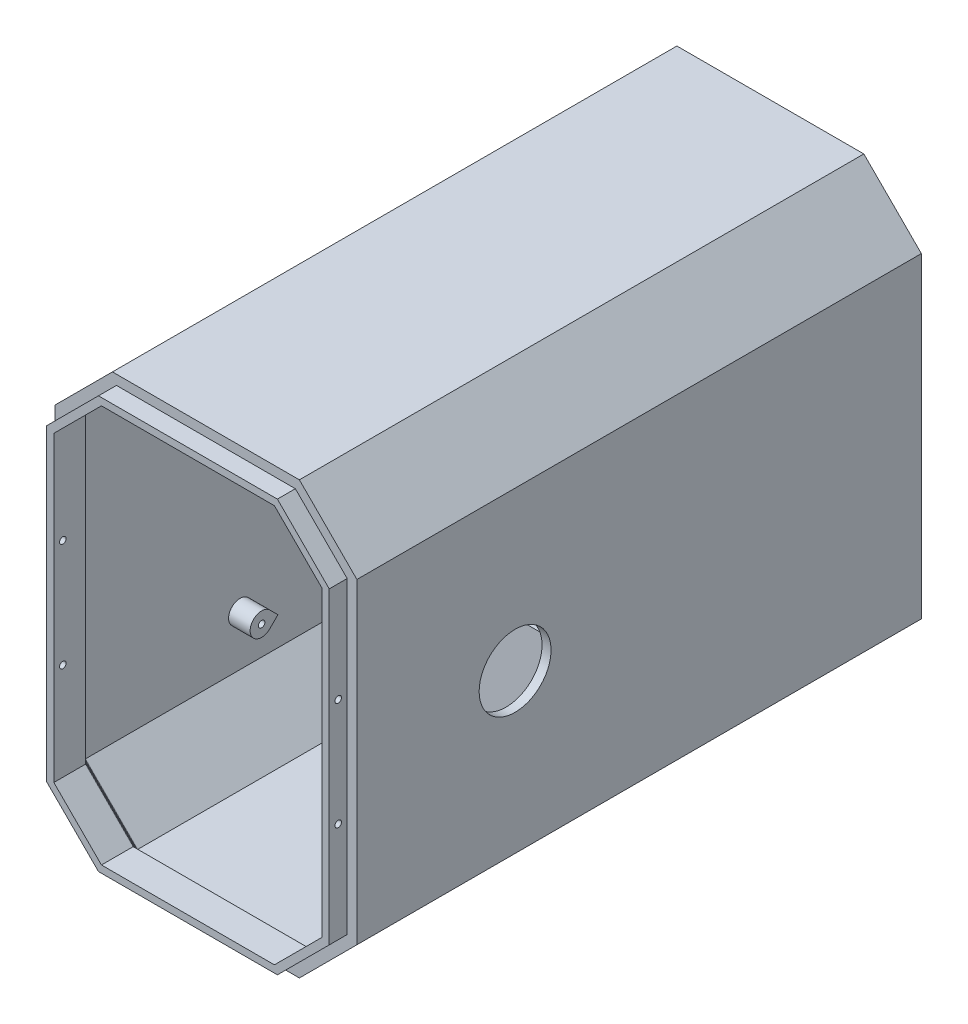
from build123d import *

# Parameters (mm, degrees)
BOSS_1_DEPTH    = 157
CUT_2_DEPTH     = 122.675
CUT_3_DEPTH     = 32.025
S_CUT4_W        = 8
S_CUT4_H        = 28
POCKET_4_DEPTH  = 2.7
S_HOLE5_R       = 6
HOLE_5_DEPTH    = 2.7
S_CUT6_W        = 19.4
S_CUT6_H        = 6.3
POCKET_6_DEPTH  = 2.7
S_CUT7_W        = 19.4
S_CUT7_H        = 6.3
POCKET_7_DEPTH  = 2.7
S_HOLE8_R       = 1.7
HOLE_8_DEPTH    = 2.7
S_HOLE9_R       = 1.7
HOLE_9_DEPTH    = 2.7
S_HOLE10_R      = 1.7
HOLE_10_DEPTH   = 2.7
S_HOLE11_R      = 1.7
HOLE_11_DEPTH   = 2.7
BOSS_12_DEPTH   = 6
BOSS_13_DEPTH   = 5.1
S_CYL14_R       = 3.2
BOSS_14_DEPTH   = 6.5
BOSS_15_DEPTH   = 6.5
S_CYL16_R       = 3.2
BOSS_16_DEPTH   = 6.5
BOSS_17_DEPTH   = 6.5
S_CYL18_R       = 3.2
BOSS_18_DEPTH   = 6.5
BOSS_19_DEPTH   = 6.5
S_CYL20_R       = 3.2
BOSS_20_DEPTH   = 6.5
BOSS_21_DEPTH   = 6.5
S_BOX22_W       = 25.8
S_BOX22_H       = 69
BOSS_22_DEPTH   = 6
BOSS_23_DEPTH   = 69
CUT_24_DEPTH    = 8.9
CUT_25_DEPTH    = 0.3
CUT_26_DEPTH    = 0.3
CUT_27_DEPTH    = 0.3
CUT_28_DEPTH    = 0.3
CUT_29_DEPTH    = 0.3
CUT_30_DEPTH    = 0.3
CUT_31_DEPTH    = 0.3
CUT_32_DEPTH    = 0.3
CUT_33_DEPTH    = 0.3
CUT_34_DEPTH    = 0.3
CUT_35_DEPTH    = 0.3
S_HOLE36_R      = 0.9
HOLE_36_DEPTH   = 2.7
S_HOLE37_R      = 0.9
HOLE_37_DEPTH   = 2.7
S_HOLE38_R      = 0.9
HOLE_38_DEPTH   = 2.7
S_HOLE39_R      = 0.9
HOLE_39_DEPTH   = 2.7
S_HOLE40_R      = 0.9
HOLE_40_DEPTH   = 7.2
S_HOLE41_R      = 0.9
HOLE_41_DEPTH   = 7.2
S_HOLE42_R      = 0.9
HOLE_42_DEPTH   = 7.2
S_HOLE43_R      = 0.9
HOLE_43_DEPTH   = 7.2
S_HOLE44_R      = 10
HOLE_44_DEPTH   = 3.1
S_CUT45_W       = 24.9
S_CUT45_H       = 10
POCKET_45_DEPTH = 4.1
S_HOLE46_R      = 0.9
HOLE_46_DEPTH   = 9.1
S_HOLE47_R      = 0.9
HOLE_47_DEPTH   = 9.1


with BuildPart() as part:
    # S_prism1 → Boss_1 (new body)
    with BuildSketch(Plane.XY.offset(37)):
        Polygon((42, -44), (42, 44), (26, 60), (-26, 60), (-42, 44), (-42, -44), (-26, -60), (26, -60), align=None)
    extrude(amount=BOSS_1_DEPTH)

    # S_pcut2 → Cut_2 (cut)
    with BuildSketch(Plane.XY.offset(71.425)):
        Polygon((39.5, -42.964466094), (39.5, 42.964466094), (24.964466094, 57.5), (-24.964466094, 57.5), (-39.5, 42.964466094), (-39.5, -42.964466094), (-24.964466094, -57.5), (24.964466094, -57.5), align=None)
    extrude(amount=CUT_2_DEPTH, mode=Mode.SUBTRACT)

    # S_pcut3 → Cut_3 (cut)
    with BuildSketch(Plane.XY.offset(36.9)):
        Polygon((39.5, -42.964466094), (39.5, 42.964466094), (24.964466094, 57.5), (-24.964466094, 57.5), (-39.5, 42.964466094), (-39.5, -42.964466094), (-24.964466094, -57.5), (24.964466094, -57.5), align=None)
    extrude(amount=CUT_3_DEPTH, mode=Mode.SUBTRACT)

    # S_cut4 → Pocket_4 (cut)
    with BuildSketch(Plane.XY.offset(68.825)):
        with Locations((-30, 0)):
            Rectangle(S_CUT4_W, S_CUT4_H)
    extrude(amount=POCKET_4_DEPTH, mode=Mode.SUBTRACT)

    # S_hole5 → Hole_5 (cut)
    with BuildSketch(Plane(origin=(-42.1, 0, 0), x_dir=(0, 0, -1), z_dir=(1, 0, 0))):
        with Locations((-88, 0)):
            Circle(S_HOLE5_R)
    extrude(amount=HOLE_5_DEPTH, mode=Mode.SUBTRACT)

    # S_cut6 → Pocket_6 (cut)
    with BuildSketch(Plane.XY.offset(68.825)):
        with Locations((0, 30.95)):
            Rectangle(S_CUT6_W, S_CUT6_H)
    extrude(amount=POCKET_6_DEPTH, mode=Mode.SUBTRACT)

    # S_cut7 → Pocket_7 (cut)
    with BuildSketch(Plane.XY.offset(68.825)):
        with Locations((0, -30.95)):
            Rectangle(S_CUT7_W, S_CUT7_H)
    extrude(amount=POCKET_7_DEPTH, mode=Mode.SUBTRACT)

    # S_hole8 → Hole_8 (cut)
    with BuildSketch(Plane.XY.offset(68.825)):
        with Locations((-20, -25)):
            Circle(S_HOLE8_R)
    extrude(amount=HOLE_8_DEPTH, mode=Mode.SUBTRACT)

    # S_hole9 → Hole_9 (cut)
    with BuildSketch(Plane.XY.offset(68.825)):
        with Locations((-20, 25)):
            Circle(S_HOLE9_R)
    extrude(amount=HOLE_9_DEPTH, mode=Mode.SUBTRACT)

    # S_hole10 → Hole_10 (cut)
    with BuildSketch(Plane.XY.offset(68.825)):
        with Locations((24, -25)):
            Circle(S_HOLE10_R)
    extrude(amount=HOLE_10_DEPTH, mode=Mode.SUBTRACT)

    # S_hole11 → Hole_11 (cut)
    with BuildSketch(Plane.XY.offset(68.825)):
        with Locations((24, 25)):
            Circle(S_HOLE11_R)
    extrude(amount=HOLE_11_DEPTH, mode=Mode.SUBTRACT)

    # S_prism12 → Boss_12 (add)
    with BuildSketch(Plane.XY.offset(188)):
        Polygon((40, -43.171572875), (40, 43.171572875), (25.171572875, 58), (-25.171572875, 58), (-40, 43.171572875), (-40, -43.171572875), (-25.171572875, -58), (25.171572875, -58), align=None)
    extrude(amount=BOSS_12_DEPTH)

    # S_prism13 → Boss_13 (add)
    with BuildSketch(Plane.XY.offset(193.9)):
        Polygon((39.3, -42.881623382), (39.3, 42.881623382), (24.881623382, 57.3), (-24.881623382, 57.3), (-39.3, 42.881623382), (-39.3, -42.881623382), (-24.881623382, -57.3), (24.881623382, -57.3), align=None)
    extrude(amount=BOSS_13_DEPTH)

    # S_cyl14 → Boss_14 (add)
    with BuildSketch(Plane(origin=(-40, 0, 0), x_dir=(0, 0, -1), z_dir=(1, 0, 0))):
        with Locations((-96, -29)):
            Circle(S_CYL14_R)
    extrude(amount=BOSS_14_DEPTH)

    # S_prism15 → Boss_15 (add)
    with BuildSketch(Plane(origin=(-40, 0, 0), x_dir=(0, 0, -1), z_dir=(1, 0, 0))):
        Polygon((-93.74, -31.26), (-93.74, -26.74), (-91.47, -29), align=None)
    extrude(amount=BOSS_15_DEPTH)

    # S_cyl16 → Boss_16 (add)
    with BuildSketch(Plane(origin=(-40, 0, 0), x_dir=(0, 0, -1), z_dir=(1, 0, 0))):
        with Locations((-145, -29)):
            Circle(S_CYL16_R)
    extrude(amount=BOSS_16_DEPTH)

    # S_prism17 → Boss_17 (add)
    with BuildSketch(Plane(origin=(-40, 0, 0), x_dir=(0, 0, -1), z_dir=(1, 0, 0))):
        Polygon((-142.74, -31.26), (-142.74, -26.74), (-140.47, -29), align=None)
    extrude(amount=BOSS_17_DEPTH)

    # S_cyl18 → Boss_18 (add)
    with BuildSketch(Plane(origin=(-40, 0, 0), x_dir=(0, 0, -1), z_dir=(1, 0, 0))):
        with Locations((-96, 29)):
            Circle(S_CYL18_R)
    extrude(amount=BOSS_18_DEPTH)

    # S_prism19 → Boss_19 (add)
    with BuildSketch(Plane(origin=(-40, 0, 0), x_dir=(0, 0, -1), z_dir=(1, 0, 0))):
        Polygon((-93.74, 26.74), (-93.74, 31.26), (-91.47, 29), align=None)
    extrude(amount=BOSS_19_DEPTH)

    # S_cyl20 → Boss_20 (add)
    with BuildSketch(Plane(origin=(-40, 0, 0), x_dir=(0, 0, -1), z_dir=(1, 0, 0))):
        with Locations((-145, 29)):
            Circle(S_CYL20_R)
    extrude(amount=BOSS_20_DEPTH)

    # S_prism21 → Boss_21 (add)
    with BuildSketch(Plane(origin=(-40, 0, 0), x_dir=(0, 0, -1), z_dir=(1, 0, 0))):
        Polygon((-142.74, 26.74), (-142.74, 31.26), (-140.47, 29), align=None)
    extrude(amount=BOSS_21_DEPTH)

    # S_box22 → Boss_22 (add)
    with BuildSketch(Plane.XY.offset(126.2)):
        with Locations((27.1, 0)):
            Rectangle(S_BOX22_W, S_BOX22_H)
    extrude(amount=BOSS_22_DEPTH)

    # S_prism23 → Boss_23 (add)
    with BuildSketch(Plane(origin=(0, -34.5, 0), x_dir=(1, 0, 0), z_dir=(0, 1, 0))):
        Polygon((14.2, -126.25), (40, -126.25), (40, -100.4), align=None)
    extrude(amount=BOSS_23_DEPTH)

    # S_pcut24 → Cut_24 (cut)
    with BuildSketch(Plane.XY.offset(190.2)):
        Polygon((37.3, -42.053196257), (37.3, 42.053196257), (24.053196257, 55.3), (-24.053196257, 55.3), (-37.3, 42.053196257), (-37.3, -42.053196257), (-24.053196257, -55.3), (24.053196257, -55.3), align=None)
    extrude(amount=CUT_24_DEPTH, mode=Mode.SUBTRACT)

    # S_pcut25 → Cut_25 (cut)
    with BuildSketch(Plane.XY.offset(187.9)):
        Polygon((39.48, -42.956181823), (39.48, 42.956181823), (24.956181823, 57.48), (-24.956181823, 57.48), (-39.48, 42.956181823), (-39.48, -42.956181823), (-24.956181823, -57.48), (24.956181823, -57.48), align=None)
    extrude(amount=CUT_25_DEPTH, mode=Mode.SUBTRACT)

    # S_pcut26 → Cut_26 (cut)
    with BuildSketch(Plane.XY.offset(188.1)):
        Polygon((39.28, -42.87333911), (39.28, 42.87333911), (24.87333911, 57.28), (-24.87333911, 57.28), (-39.28, 42.87333911), (-39.28, -42.87333911), (-24.87333911, -57.28), (24.87333911, -57.28), align=None)
    extrude(amount=CUT_26_DEPTH, mode=Mode.SUBTRACT)

    # S_pcut27 → Cut_27 (cut)
    with BuildSketch(Plane.XY.offset(188.3)):
        Polygon((39.08, -42.790496398), (39.08, 42.790496398), (24.790496398, 57.08), (-24.790496398, 57.08), (-39.08, 42.790496398), (-39.08, -42.790496398), (-24.790496398, -57.08), (24.790496398, -57.08), align=None)
    extrude(amount=CUT_27_DEPTH, mode=Mode.SUBTRACT)

    # S_pcut28 → Cut_28 (cut)
    with BuildSketch(Plane.XY.offset(188.5)):
        Polygon((38.88, -42.707653685), (38.88, 42.707653685), (24.707653685, 56.88), (-24.707653685, 56.88), (-38.88, 42.707653685), (-38.88, -42.707653685), (-24.707653685, -56.88), (24.707653685, -56.88), align=None)
    extrude(amount=CUT_28_DEPTH, mode=Mode.SUBTRACT)

    # S_pcut29 → Cut_29 (cut)
    with BuildSketch(Plane.XY.offset(188.7)):
        Polygon((38.68, -42.624810973), (38.68, 42.624810973), (24.624810973, 56.68), (-24.624810973, 56.68), (-38.68, 42.624810973), (-38.68, -42.624810973), (-24.624810973, -56.68), (24.624810973, -56.68), align=None)
    extrude(amount=CUT_29_DEPTH, mode=Mode.SUBTRACT)

    # S_pcut30 → Cut_30 (cut)
    with BuildSketch(Plane.XY.offset(188.9)):
        Polygon((38.48, -42.54196826), (38.48, 42.54196826), (24.54196826, 56.48), (-24.54196826, 56.48), (-38.48, 42.54196826), (-38.48, -42.54196826), (-24.54196826, -56.48), (24.54196826, -56.48), align=None)
    extrude(amount=CUT_30_DEPTH, mode=Mode.SUBTRACT)

    # S_pcut31 → Cut_31 (cut)
    with BuildSketch(Plane.XY.offset(189.1)):
        Polygon((38.28, -42.459125548), (38.28, 42.459125548), (24.459125548, 56.28), (-24.459125548, 56.28), (-38.28, 42.459125548), (-38.28, -42.459125548), (-24.459125548, -56.28), (24.459125548, -56.28), align=None)
    extrude(amount=CUT_31_DEPTH, mode=Mode.SUBTRACT)

    # S_pcut32 → Cut_32 (cut)
    with BuildSketch(Plane.XY.offset(189.3)):
        Polygon((38.08, -42.376282835), (38.08, 42.376282835), (24.376282835, 56.08), (-24.376282835, 56.08), (-38.08, 42.376282835), (-38.08, -42.376282835), (-24.376282835, -56.08), (24.376282835, -56.08), align=None)
    extrude(amount=CUT_32_DEPTH, mode=Mode.SUBTRACT)

    # S_pcut33 → Cut_33 (cut)
    with BuildSketch(Plane.XY.offset(189.5)):
        Polygon((37.88, -42.293440123), (37.88, 42.293440123), (24.293440123, 55.88), (-24.293440123, 55.88), (-37.88, 42.293440123), (-37.88, -42.293440123), (-24.293440123, -55.88), (24.293440123, -55.88), align=None)
    extrude(amount=CUT_33_DEPTH, mode=Mode.SUBTRACT)

    # S_pcut34 → Cut_34 (cut)
    with BuildSketch(Plane.XY.offset(189.7)):
        Polygon((37.68, -42.210597411), (37.68, 42.210597411), (24.210597411, 55.68), (-24.210597411, 55.68), (-37.68, 42.210597411), (-37.68, -42.210597411), (-24.210597411, -55.68), (24.210597411, -55.68), align=None)
    extrude(amount=CUT_34_DEPTH, mode=Mode.SUBTRACT)

    # S_pcut35 → Cut_35 (cut)
    with BuildSketch(Plane.XY.offset(189.9)):
        Polygon((37.48, -42.127754698), (37.48, 42.127754698), (24.127754698, 55.48), (-24.127754698, 55.48), (-37.48, 42.127754698), (-37.48, -42.127754698), (-24.127754698, -55.48), (24.127754698, -55.48), align=None)
    extrude(amount=CUT_35_DEPTH, mode=Mode.SUBTRACT)

    # S_hole36 → Hole_36 (cut)
    with BuildSketch(Plane(origin=(37.1, 0, 0), x_dir=(0, 0, -1), z_dir=(1, 0, 0))):
        with Locations((-196.5, -15)):
            Circle(S_HOLE36_R)
    extrude(amount=HOLE_36_DEPTH, mode=Mode.SUBTRACT)

    # S_hole37 → Hole_37 (cut)
    with BuildSketch(Plane(origin=(37.1, 0, 0), x_dir=(0, 0, -1), z_dir=(1, 0, 0))):
        with Locations((-196.5, 15)):
            Circle(S_HOLE37_R)
    extrude(amount=HOLE_37_DEPTH, mode=Mode.SUBTRACT)

    # S_hole38 → Hole_38 (cut)
    with BuildSketch(Plane(origin=(-39.8, 0, 0), x_dir=(0, 0, -1), z_dir=(1, 0, 0))):
        with Locations((-196.5, -15)):
            Circle(S_HOLE38_R)
    extrude(amount=HOLE_38_DEPTH, mode=Mode.SUBTRACT)

    # S_hole39 → Hole_39 (cut)
    with BuildSketch(Plane(origin=(-39.8, 0, 0), x_dir=(0, 0, -1), z_dir=(1, 0, 0))):
        with Locations((-196.5, 15)):
            Circle(S_HOLE39_R)
    extrude(amount=HOLE_39_DEPTH, mode=Mode.SUBTRACT)

    # S_hole40 → Hole_40 (cut)
    with BuildSketch(Plane(origin=(-40.6, 0, 0), x_dir=(0, 0, -1), z_dir=(1, 0, 0))):
        with Locations((-96, -29)):
            Circle(S_HOLE40_R)
    extrude(amount=HOLE_40_DEPTH, mode=Mode.SUBTRACT)

    # S_hole41 → Hole_41 (cut)
    with BuildSketch(Plane(origin=(-40.6, 0, 0), x_dir=(0, 0, -1), z_dir=(1, 0, 0))):
        with Locations((-145, -29)):
            Circle(S_HOLE41_R)
    extrude(amount=HOLE_41_DEPTH, mode=Mode.SUBTRACT)

    # S_hole42 → Hole_42 (cut)
    with BuildSketch(Plane(origin=(-40.6, 0, 0), x_dir=(0, 0, -1), z_dir=(1, 0, 0))):
        with Locations((-96, 29)):
            Circle(S_HOLE42_R)
    extrude(amount=HOLE_42_DEPTH, mode=Mode.SUBTRACT)

    # S_hole43 → Hole_43 (cut)
    with BuildSketch(Plane(origin=(-40.6, 0, 0), x_dir=(0, 0, -1), z_dir=(1, 0, 0))):
        with Locations((-145, 29)):
            Circle(S_HOLE43_R)
    extrude(amount=HOLE_43_DEPTH, mode=Mode.SUBTRACT)

    # S_hole44 → Hole_44 (cut)
    with BuildSketch(Plane(origin=(39, 0, 0), x_dir=(0, 0, -1), z_dir=(1, 0, 0))):
        with Locations((-150, 0)):
            Circle(S_HOLE44_R)
    extrude(amount=HOLE_44_DEPTH, mode=Mode.SUBTRACT)

    # S_cut45 → Pocket_45 (cut)
    with BuildSketch(Plane.XY.offset(128.2)):
        with Locations((26.55, 0)):
            Rectangle(S_CUT45_W, S_CUT45_H)
    extrude(amount=POCKET_45_DEPTH, mode=Mode.SUBTRACT)

    # S_hole46 → Hole_46 (cut)
    with BuildSketch(Plane(origin=(14.1, 0, 0), x_dir=(0, 0, -1), z_dir=(1, 0, 0))):
        with Locations((-129.2, -22)):
            Circle(S_HOLE46_R)
    extrude(amount=HOLE_46_DEPTH, mode=Mode.SUBTRACT)

    # S_hole47 → Hole_47 (cut)
    with BuildSketch(Plane(origin=(14.1, 0, 0), x_dir=(0, 0, -1), z_dir=(1, 0, 0))):
        with Locations((-129.2, 22)):
            Circle(S_HOLE47_R)
    extrude(amount=HOLE_47_DEPTH, mode=Mode.SUBTRACT)


solid = part.part
